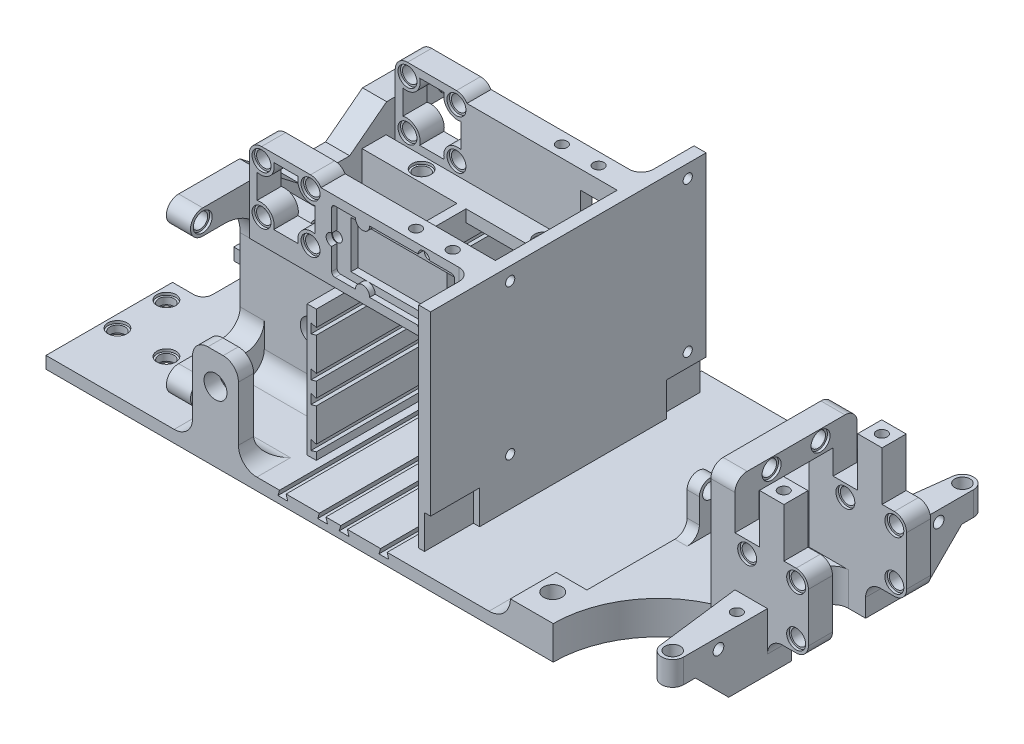
from build123d import *

# Parameters (mm, degrees)
SALIENTE_EXTRUIR1_DEPTH      = 42.87
SALIENTE_EXTRUIR1_DEPTH_BACK = 3.9
CROQUIS2_W                   = 41.87
CROQUIS2_H                   = 39.8
CROQUIS2_W_2                 = 31
CROQUIS2_H_2                 = 24.1
CROQUIS5_R                   = 3.75
CORTAR_EXTRUIR4_DEPTH        = 63.992331279
CROQUIS3_R                   = 2.485
CORTAR_EXTRUIR1_DEPTH        = 7.87
CROQUIS3_3_R                 = 2.485
CROQUIS3_3_R_2               = 3.1
CORTAR_EXTRUIR2_DEPTH        = 0.85
CORTAR_EXTRUIR3_START        = -7.02
CROQUIS3_4_R                 = 3.1
CROQUIS3_4_R_2               = 2.485
CORTAR_EXTRUIR3_DEPTH        = 0.85
CROQUIS4_W                   = 41.5
CROQUIS4_H                   = 7.9
CROQUIS4_R                   = 3.1
SALIENTE_EXTRUIR2_DEPTH      = 3.935
SALIENTE_EXTRUIR3_START      = -0.85
CROQUIS4_3_R                 = 3.1
CROQUIS4_3_R_2               = 2.485
SALIENTE_EXTRUIR3_DEPTH      = 2.235
CROQUIS6_W                   = 193.7
CROQUIS6_H                   = 102.67
CROQUIS6_R                   = 3.1
CROQUIS6_W_2                 = 31
CROQUIS6_H_2                 = 24.1
SALIENTE_EXTRUIR4_DEPTH      = 3.935
SALIENTE_EXTRUIR6_START      = 0.85
CROQUIS6_5_R                 = 3.1
CROQUIS6_5_R_2               = 2.485
SALIENTE_EXTRUIR6_DEPTH      = 2.235
CORTAR_EXTRUIR7_REACH        = 158.006
CROQUIS10_R                  = 3.1
SALIENTE_EXTRUIR7_DEPTH      = 7.87
SALIENTE_EXTRUIR8_START      = -0.85
CROQUIS10_3_R                = 3.1
CROQUIS10_3_R_2              = 2.485
SALIENTE_EXTRUIR8_DEPTH      = 6.17
CROQUIS12_R                  = 3.1
CROQUIS12_W                  = 24
CROQUIS12_H                  = 3.935
SALIENTE_EXTRUIR11_DEPTH     = 7.87
SALIENTE_EXTRUIR15_START     = 0.85
CROQUIS12_5_R                = 3.1
CROQUIS12_5_R_2              = 2.485
SALIENTE_EXTRUIR15_DEPTH     = 6.17
SALIENTE_EXTRUIR13_START     = -46.82
CROQUIS12_4_R                = 3.1
CROQUIS12_4_R_2              = 2.485
SALIENTE_EXTRUIR13_DEPTH     = 6.17
SALIENTE_EXTRUIR14_DEPTH     = 7.87
CORTAR_EXTRUIR8_START        = 7.87
CORTAR_EXTRUIR8_DEPTH        = 1.8
CROQUIS14_R                  = 1.6
CORTAR_EXTRUIR10_DEPTH       = 2.3
CORTAR_EXTRUIR11_START       = -51.94
CROQUIS14_3_R                = 1.6
CORTAR_EXTRUIR11_DEPTH       = 1.8
CROQUIS18_W                  = 12
CROQUIS18_H                  = 14
CORTAR_EXTRUIR14_DEPTH       = 173.813155822
CROQUIS23_W                  = 32
CROQUIS23_H                  = 102.67
SALIENTE_EXTRUIR16_DEPTH     = 6.97
CROQUIS25_R                  = 3.1
SALIENTE_EXTRUIR18_DEPTH     = 7.87
SALIENTE_EXTRUIR19_START     = -0.85
CROQUIS25_3_R                = 3.1
CROQUIS25_3_R_2              = 2.485
SALIENTE_EXTRUIR19_DEPTH     = 6.17
CROQUIS27_R                  = 2.525
SALIENTE_EXTRUIR20_DEPTH     = 4
CROQUIS30_R                  = 3.1
SALIENTE_EXTRUIR21_DEPTH     = 7.87
SALIENTE_EXTRUIR22_START     = -0.85
CROQUIS30_3_R                = 3.1
CROQUIS30_3_R_2              = 2.485
SALIENTE_EXTRUIR22_DEPTH     = 6.17
CORTAR_EXTRUIR15_DEPTH       = 182.802877727
CROQUIS24_4_R                = 2.5
SALIENTE_EXTRUIR23_DEPTH     = 7.87
SALIENTE_EXTRUIR28_START     = -10.62
SALIENTE_EXTRUIR28_DEPTH     = 10.62
CORTAR_EXTRUIR25_REACH       = 183.803
SALIENTE_EXTRUIR24_START     = 25.05
CROQUIS30_5_R                = 3.1
CROQUIS30_5_R_2              = 2.485
SALIENTE_EXTRUIR24_DEPTH     = 6.17
REDONDEO10_R                 = 5
CROQUIS52_W                  = 10
CROQUIS52_H                  = 15
SALIENTE_EXTRUIR29_DEPTH     = 6.97
CROQUIS34_R                  = 3
CORTAR_EXTRUIR19_DEPTH       = 5
CROQUIS39_R                  = 1.75
CORTAR_EXTRUIR20_DEPTH       = 5
CROQUIS41_R                  = 3.75
SALIENTE_EXTRUIR26_DEPTH     = 4.97
CROQUIS47_W                  = 90
CROQUIS47_H                  = 68.8
CROQUIS47_R                  = 1.5
SALIENTE_EXTRUIR27_DEPTH     = 3.935
REDONDEO7_R                  = 4
REDONDEO8_R                  = 7.87
REDONDEO9_R                  = 6
CROQUIS50_R                  = 1.75
CORTAR_EXTRUIR26_DEPTH       = 5
CROQUIS51_R                  = 1.75
CORTAR_EXTRUIR27_DEPTH       = 5
CROQUIS53_W                  = 8
CROQUIS53_H                  = 7.87
SALIENTE_EXTRUIR30_DEPTH     = 16
CROQUIS54_R                  = 1.75
CORTAR_EXTRUIR28_DEPTH       = 5
REDONDEO11_R                 = 6.97
CROQUIS55_W                  = 13
CROQUIS55_H                  = 11
CROQUIS55_W_2                = 16
CORTAR_EXTRUIR29_DEPTH       = 2
REDONDEO12_R                 = 4
CROQUIS56_W                  = 3
CROQUIS56_H                  = 17
SALIENTE_EXTRUIR33_DEPTH     = 42.8
CORTAR_EXTRUIR30_DEPTH       = 204.380812025


with BuildPart() as part:
    # Croquis2 → Saliente-Extruir1 (new, two sides: drawn at the far end of the back side and taken through both)
    with BuildSketch(Plane(origin=(0, 0, 0), x_dir=(1, 0, 0), z_dir=(0, 1, 0)).offset(-SALIENTE_EXTRUIR1_DEPTH_BACK)):
        with Locations((-2.435, 0)):
            Rectangle(CROQUIS2_W, CROQUIS2_H)
        Rectangle(CROQUIS2_W_2, CROQUIS2_H_2, mode=Mode.SUBTRACT)
    extrude(amount=SALIENTE_EXTRUIR1_DEPTH + SALIENTE_EXTRUIR1_DEPTH_BACK)

    # Croquis5 → Cortar-Extruir4 (cut, through all)
    with BuildSketch(Plane.XY.offset(19.9)):
        with Locations((0, 15)):
            Circle(CROQUIS5_R)
    extrude(amount=-CORTAR_EXTRUIR4_DEPTH, mode=Mode.SUBTRACT)

    # Croquis3 → Cortar-Extruir1 (cut)
    with BuildSketch(Plane(origin=(0, 42.87, 0), x_dir=(1, 0, 0), z_dir=(0, 1, 0))):
        with Locations(Location((0, -16, 0), (0, 0, 270))):
            Circle(CROQUIS3_R)
    cortar_extruir1 = extrude(amount=-CORTAR_EXTRUIR1_DEPTH, mode=Mode.SUBTRACT)

    # Croquis3<3> → Cortar-Extruir2 (cut)
    with BuildSketch(Plane(origin=(0, 42.87, 0), x_dir=(1, 0, 0), z_dir=(0, 1, 0))):
        with Locations(Location((0, -16, 0), (0, 0, 270))):
            Circle(CROQUIS3_3_R)
        with Locations(Location((0, -16, 0), (0, 0, 270))):
            Circle(CROQUIS3_3_R_2)
    cortar_extruir2 = extrude(amount=-CORTAR_EXTRUIR2_DEPTH, mode=Mode.SUBTRACT)

    # Croquis3<4> → Cortar-Extruir3 (cut)
    with BuildSketch(Plane(origin=(0, 42.87, 0), x_dir=(1, 0, 0), z_dir=(0, 1, 0)).offset(CORTAR_EXTRUIR3_START)):
        with Locations(Location((0, -16, 0), (0, 0, 270))):
            Circle(CROQUIS3_4_R)
        with Locations(Location((0, -16, 0), (0, 0, 270))):
            Circle(CROQUIS3_4_R_2, mode=Mode.SUBTRACT)
    cortar_extruir3 = extrude(amount=-CORTAR_EXTRUIR3_DEPTH, mode=Mode.SUBTRACT)

    # Simetría1: Cortar-Extruir1, Cortar-Extruir2, Cortar-Extruir3 across plane
    add(cortar_extruir1.mirror(Plane.XY), mode=Mode.SUBTRACT)
    add(cortar_extruir2.mirror(Plane.XY), mode=Mode.SUBTRACT)
    add(cortar_extruir3.mirror(Plane.XY), mode=Mode.SUBTRACT)

    # Croquis4 → Saliente-Extruir2 (add)
    with BuildSketch(Plane(origin=(0, 42.87, 0), x_dir=(1, 0, 0), z_dir=(0, 1, 0))):
        with Locations((39.25, -15.95)):
            Rectangle(CROQUIS4_W, CROQUIS4_H)
        with Locations(Location((40, -16, 0), (0, 0, 270))):
            Circle(CROQUIS4_R, mode=Mode.SUBTRACT)
        with Locations(Location((56, -16, 0), (0, 0, 270))):
            Circle(CROQUIS4_R, mode=Mode.SUBTRACT)
    saliente_extruir2 = extrude(amount=-SALIENTE_EXTRUIR2_DEPTH)

    # Croquis4<3> → Saliente-Extruir3 (add)
    # profile 1 of 2: a face of its own
    with BuildSketch(Plane(origin=(0, 42.87, 0), x_dir=(1, 0, 0), z_dir=(0, 1, 0)).offset(SALIENTE_EXTRUIR3_START)):
        with Locations(Location((40, -16, 0), (0, 0, 270))):
            Circle(CROQUIS4_3_R)
        with Locations(Location((40, -16, 0), (0, 0, 270))):
            Circle(CROQUIS4_3_R_2, mode=Mode.SUBTRACT)
    # profile 2 of 2: a face of its own
    with BuildSketch(Plane(origin=(0, 42.87, 0), x_dir=(1, 0, 0), z_dir=(0, 1, 0)).offset(SALIENTE_EXTRUIR3_START)):
        with Locations(Location((56, -16, 0), (0, 0, 270))):
            Circle(CROQUIS4_3_R)
        with Locations(Location((56, -16, 0), (0, 0, 270))):
            Circle(CROQUIS4_3_R_2, mode=Mode.SUBTRACT)
    saliente_extruir3 = extrude(amount=-SALIENTE_EXTRUIR3_DEPTH)

    # Simetría11: Saliente-Extruir2 across plane
    add(saliente_extruir2.mirror(Plane.XY))

    # Simetría13: Saliente-Extruir3 across plane
    add(saliente_extruir3.mirror(Plane.XY))

    # Croquis6 → Saliente-Extruir4 (add)
    with BuildSketch(Plane(origin=(0, -7.8, 0), x_dir=(1, 0, 0), z_dir=(0, 1, 0))):
        with Locations((41.48, 0)):
            Rectangle(CROQUIS6_W, CROQUIS6_H)
        with Locations(Location((-51.37, -32, 0), (0, 0, 270))):
            Circle(CROQUIS6_R, mode=Mode.SUBTRACT)
        with Locations(Location((-35.37, -32, 0), (0, 0, 270))):
            Circle(CROQUIS6_R, mode=Mode.SUBTRACT)
        with Locations(Location((-51.37, -16, 0), (0, 0, 270))):
            Circle(CROQUIS6_R, mode=Mode.SUBTRACT)
        with Locations(Location((-51.37, 16, 0), (0, 0, 270))):
            Circle(CROQUIS6_R, mode=Mode.SUBTRACT)
        Rectangle(CROQUIS6_W_2, CROQUIS6_H_2, mode=Mode.SUBTRACT)
        with Locations(Location((-51.37, 32, 0), (0, 0, 270))):
            Circle(CROQUIS6_R, mode=Mode.SUBTRACT)
        with Locations(Location((-35.37, 32, 0), (0, 0, 270))):
            Circle(CROQUIS6_R, mode=Mode.SUBTRACT)
    extrude(amount=SALIENTE_EXTRUIR4_DEPTH)

    # Croquis6<5> → Saliente-Extruir6 (add)
    # profile 1 of 6: a face of its own
    with BuildSketch(Plane(origin=(0, -7.8, 0), x_dir=(1, 0, 0), z_dir=(0, 1, 0)).offset(SALIENTE_EXTRUIR6_START)):
        with Locations(Location((-51.37, -32, 0), (0, 0, 270))):
            Circle(CROQUIS6_5_R)
        with Locations(Location((-51.37, -32, 0), (0, 0, 270))):
            Circle(CROQUIS6_5_R_2, mode=Mode.SUBTRACT)
    # profile 2 of 6: a face of its own
    with BuildSketch(Plane(origin=(0, -7.8, 0), x_dir=(1, 0, 0), z_dir=(0, 1, 0)).offset(SALIENTE_EXTRUIR6_START)):
        with Locations(Location((-51.37, -16, 0), (0, 0, 270))):
            Circle(CROQUIS6_5_R)
        with Locations(Location((-51.37, -16, 0), (0, 0, 270))):
            Circle(CROQUIS6_5_R_2, mode=Mode.SUBTRACT)
    # profile 3 of 6: a face of its own
    with BuildSketch(Plane(origin=(0, -7.8, 0), x_dir=(1, 0, 0), z_dir=(0, 1, 0)).offset(SALIENTE_EXTRUIR6_START)):
        with Locations(Location((-35.37, -32, 0), (0, 0, 270))):
            Circle(CROQUIS6_5_R)
        with Locations(Location((-35.37, -32, 0), (0, 0, 270))):
            Circle(CROQUIS6_5_R_2, mode=Mode.SUBTRACT)
    # profile 4 of 6: a face of its own
    with BuildSketch(Plane(origin=(0, -7.8, 0), x_dir=(1, 0, 0), z_dir=(0, 1, 0)).offset(SALIENTE_EXTRUIR6_START)):
        with Locations(Location((-35.37, 32, 0), (0, 0, 270))):
            Circle(CROQUIS6_5_R)
        with Locations(Location((-35.37, 32, 0), (0, 0, 270))):
            Circle(CROQUIS6_5_R_2, mode=Mode.SUBTRACT)
    # profile 5 of 6: a face of its own
    with BuildSketch(Plane(origin=(0, -7.8, 0), x_dir=(1, 0, 0), z_dir=(0, 1, 0)).offset(SALIENTE_EXTRUIR6_START)):
        with Locations(Location((-51.37, 32, 0), (0, 0, 270))):
            Circle(CROQUIS6_5_R)
        with Locations(Location((-51.37, 32, 0), (0, 0, 270))):
            Circle(CROQUIS6_5_R_2, mode=Mode.SUBTRACT)
    # profile 6 of 6: a face of its own
    with BuildSketch(Plane(origin=(0, -7.8, 0), x_dir=(1, 0, 0), z_dir=(0, 1, 0)).offset(SALIENTE_EXTRUIR6_START)):
        with Locations(Location((-51.37, 16, 0), (0, 0, 270))):
            Circle(CROQUIS6_5_R)
        with Locations(Location((-51.37, 16, 0), (0, 0, 270))):
            Circle(CROQUIS6_5_R_2, mode=Mode.SUBTRACT)
    extrude(amount=SALIENTE_EXTRUIR6_DEPTH)

    # Croquis9 → Cortar-Extruir7 (cut, up to next)
    with BuildSketch(Plane.XZ.offset(7.8), mode=Mode.PRIVATE) as cortar_extruir7_sk1:
        with BuildLine():
            Line((-55.37, 10), (-48.37, 10))
            ThreePointArc((-48.37, 10), (-46.248679656, 9.121320344), (-45.37, 7))
            Line((-45.37, 7), (-45.37, -7))
            ThreePointArc((-45.37, -7), (-46.248679656, -9.121320344), (-48.37, -10))
            Line((-48.37, -10), (-55.37, -10))
            Line((-55.37, -10), (-55.37, 10))
        make_face()
    cortar_extruir7_tool1 = extrude(cortar_extruir7_sk1.sketch, amount=-CORTAR_EXTRUIR7_REACH, mode=Mode.PRIVATE) & part.part
    add(cortar_extruir7_tool1.solids().sort_by_distance((-50.455275, -7.8, 0))[0], mode=Mode.SUBTRACT)

    # Croquis10 → Saliente-Extruir7 (add)
    # profile 1 of 2: a face of its own
    with BuildSketch(Plane.ZY.offset(23.37)):
        with BuildLine():
            Line((-19.9, -3.865), (-19.9, 4.135))
            Line((-19.9, 4.135), (-40, 4.135))
            ThreePointArc((-40, 4.135), (-44, 0.135), (-40, -3.865))
            Line((-40, -3.865), (-19.9, -3.865))
        make_face()
        with Locations((-40, 0.135)):
            Circle(CROQUIS10_R, mode=Mode.SUBTRACT)
    # profile 2 of 2: a face of its own
    with BuildSketch(Plane.ZY.offset(23.37)):
        with BuildLine():
            ThreePointArc((-32.9, 44.135), (-23.707611845, 40.327388155), (-19.9, 31.135))
            Line((-19.9, 31.135), (-19.9, 42.87))
            Line((-19.9, 42.87), (-8, 42.87))
            Line((-8, 42.87), (-20.074383079, 52.135))
            Line((-20.074383079, 52.135), (-40, 52.135))
            ThreePointArc((-40, 52.135), (-44, 48.135), (-40, 44.135))
            Line((-40, 44.135), (-32.9, 44.135))
        make_face()
        with Locations((-40, 48.135)):
            Circle(CROQUIS10_R, mode=Mode.SUBTRACT)
    saliente_extruir7 = extrude(amount=-SALIENTE_EXTRUIR7_DEPTH)

    # Croquis10<3> → Saliente-Extruir8 (add)
    # profile 1 of 2: a face of its own
    with BuildSketch(Plane.ZY.offset(23.37).offset(SALIENTE_EXTRUIR8_START)):
        with Locations((-40, 0.135)):
            Circle(CROQUIS10_3_R)
        with Locations((-40, 0.135)):
            Circle(CROQUIS10_3_R_2, mode=Mode.SUBTRACT)
    # profile 2 of 2: a face of its own
    with BuildSketch(Plane.ZY.offset(23.37).offset(SALIENTE_EXTRUIR8_START)):
        with Locations((-40, 48.135)):
            Circle(CROQUIS10_3_R)
        with Locations((-40, 48.135)):
            Circle(CROQUIS10_3_R_2, mode=Mode.SUBTRACT)
    saliente_extruir8 = extrude(amount=-SALIENTE_EXTRUIR8_DEPTH)

    # Simetría14: Saliente-Extruir7, Saliente-Extruir8 across plane
    add(saliente_extruir7.mirror(Plane.XY))
    add(saliente_extruir8.mirror(Plane.XY))

    # Croquis12 → Saliente-Extruir11 (add)
    # profile 1 of 2: a face of its own
    with BuildSketch(Plane.XY.offset(19.9)):
        with BuildLine():
            Line((7.48, 66.87), (-8.52, 66.87))
            ThreePointArc((-8.52, 66.87), (-11.348427125, 65.698427125), (-12.52, 62.87))
            Line((-12.52, 62.87), (-12.52, 42.87))
            Line((-12.52, 42.87), (11.48, 42.87))
            Line((11.48, 42.87), (11.48, 62.87))
            ThreePointArc((11.48, 62.87), (10.308427125, 65.698427125), (7.48, 66.87))
        make_face()
        with Locations((-8.52, 46.87)):
            Circle(CROQUIS12_R, mode=Mode.SUBTRACT)
        with Locations((7.48, 46.87)):
            Circle(CROQUIS12_R, mode=Mode.SUBTRACT)
        with Locations((-8.52, 62.87)):
            Circle(CROQUIS12_R, mode=Mode.SUBTRACT)
        with BuildLine():
            ThreePointArc((8.98, 50.87), (4.648800544, 49.701199456), (3.48, 45.37))
            Line((3.48, 45.37), (-4.52, 45.37))
            ThreePointArc((-4.52, 45.37), (-5.688800544, 49.701199456), (-10.02, 50.87))
            Line((-10.02, 50.87), (-10.02, 58.87))
            ThreePointArc((-10.02, 58.87), (-5.688800544, 60.038800544), (-4.52, 64.37))
            Line((-4.52, 64.37), (3.48, 64.37))
            ThreePointArc((3.48, 64.37), (4.648800544, 60.038800544), (8.98, 58.87))
            Line((8.98, 58.87), (8.98, 50.87))
        make_face(mode=Mode.SUBTRACT)
        with Locations((7.48, 62.87)):
            Circle(CROQUIS12_R, mode=Mode.SUBTRACT)
    # profile 2 of 2: a face of its own
    with BuildSketch(Plane.XY.offset(19.9)):
        with Locations((-0.52, 40.9025)):
            Rectangle(CROQUIS12_W, CROQUIS12_H)
    saliente_extruir11 = extrude(amount=SALIENTE_EXTRUIR11_DEPTH)

    # Croquis12<5> → Saliente-Extruir15 (add)
    # profile 1 of 4: a face of its own
    with BuildSketch(Plane.XY.offset(19.9).offset(SALIENTE_EXTRUIR15_START)):
        with Locations((7.48, 62.87)):
            Circle(CROQUIS12_5_R)
        with Locations((7.48, 62.87)):
            Circle(CROQUIS12_5_R_2, mode=Mode.SUBTRACT)
    # profile 2 of 4: a face of its own
    with BuildSketch(Plane.XY.offset(19.9).offset(SALIENTE_EXTRUIR15_START)):
        with Locations((7.48, 46.87)):
            Circle(CROQUIS12_5_R)
        with Locations((7.48, 46.87)):
            Circle(CROQUIS12_5_R_2, mode=Mode.SUBTRACT)
    # profile 3 of 4: a face of its own
    with BuildSketch(Plane.XY.offset(19.9).offset(SALIENTE_EXTRUIR15_START)):
        with Locations((-8.52, 62.87)):
            Circle(CROQUIS12_5_R)
        with Locations((-8.52, 62.87)):
            Circle(CROQUIS12_5_R_2, mode=Mode.SUBTRACT)
    # profile 4 of 4: a face of its own
    with BuildSketch(Plane.XY.offset(19.9).offset(SALIENTE_EXTRUIR15_START)):
        with Locations((-8.52, 46.87)):
            Circle(CROQUIS12_5_R)
        with Locations((-8.52, 46.87)):
            Circle(CROQUIS12_5_R_2, mode=Mode.SUBTRACT)
    extrude(amount=SALIENTE_EXTRUIR15_DEPTH)

    # Simetría31: Saliente-Extruir11 across plane
    add(saliente_extruir11.mirror(Plane.XY))

    # Croquis12<4> → Saliente-Extruir13 (add)
    # profile 1 of 4: a face of its own
    with BuildSketch(Plane.XY.offset(19.9).offset(SALIENTE_EXTRUIR13_START)):
        with Locations((7.48, 62.87)):
            Circle(CROQUIS12_4_R)
        with Locations((7.48, 62.87)):
            Circle(CROQUIS12_4_R_2, mode=Mode.SUBTRACT)
    # profile 2 of 4: a face of its own
    with BuildSketch(Plane.XY.offset(19.9).offset(SALIENTE_EXTRUIR13_START)):
        with Locations((-8.52, 62.87)):
            Circle(CROQUIS12_4_R)
        with Locations((-8.52, 62.87)):
            Circle(CROQUIS12_4_R_2, mode=Mode.SUBTRACT)
    # profile 3 of 4: a face of its own
    with BuildSketch(Plane.XY.offset(19.9).offset(SALIENTE_EXTRUIR13_START)):
        with Locations((-8.52, 46.87)):
            Circle(CROQUIS12_4_R)
        with Locations((-8.52, 46.87)):
            Circle(CROQUIS12_4_R_2, mode=Mode.SUBTRACT)
    # profile 4 of 4: a face of its own
    with BuildSketch(Plane.XY.offset(19.9).offset(SALIENTE_EXTRUIR13_START)):
        with Locations((7.48, 46.87)):
            Circle(CROQUIS12_4_R)
        with Locations((7.48, 46.87)):
            Circle(CROQUIS12_4_R_2, mode=Mode.SUBTRACT)
    extrude(amount=SALIENTE_EXTRUIR13_DEPTH)

    # Croquis13 → Saliente-Extruir14 (add)
    with BuildSketch(Plane.XY.offset(19.9)):
        with BuildLine():
            Line((11.48, 38.935), (60, 38.935))
            Line((60, 38.935), (60, 64.935))
            Line((60, 64.935), (10.905751742, 64.935))
            ThreePointArc((10.905751742, 64.935), (11.333764846, 63.941679297), (11.48, 62.87))
            Line((11.48, 62.87), (11.48, 38.935))
        make_face()
    saliente_extruir14 = extrude(amount=SALIENTE_EXTRUIR14_DEPTH)

    # Croquis13<5> → Cortar-Extruir8 (cut)
    with BuildSketch(Plane.XY.offset(19.9).offset(CORTAR_EXTRUIR8_START)):
        with BuildLine():
            Line((14.38, 50.037633404), (14.38, 42.935))
            ThreePointArc((14.38, 42.935), (14.702182541, 42.157182541), (15.48, 41.835))
            Line((15.48, 41.835), (22.182174941, 41.835))
            ThreePointArc((22.182174941, 41.835), (24.48, 44.235), (26.777825059, 41.835))
            Line((26.777825059, 41.835), (42.582633404, 41.835))
            ThreePointArc((42.582633404, 41.835), (44.48, 40.035), (46.377366596, 41.835))
            Line((46.377366596, 41.835), (53.48, 41.835))
            ThreePointArc((53.48, 41.835), (54.257817459, 42.157182541), (54.58, 42.935))
            Line((54.58, 42.935), (54.58, 49.637174941))
            ThreePointArc((54.58, 49.637174941), (52.18, 51.935), (54.58, 54.232825059))
            Line((54.58, 54.232825059), (54.58, 60.935))
            ThreePointArc((54.58, 60.935), (54.257817459, 61.712817459), (53.48, 62.035))
            Line((53.48, 62.035), (46.377366596, 62.035))
            ThreePointArc((46.377366596, 62.035), (44.48, 63.835), (42.582633404, 62.035))
            Line((42.582633404, 62.035), (26.777825059, 62.035))
            ThreePointArc((26.777825059, 62.035), (24.48, 59.635), (22.182174941, 62.035))
            Line((22.182174941, 62.035), (15.48, 62.035))
            ThreePointArc((15.48, 62.035), (14.702182541, 61.712817459), (14.38, 60.935))
            Line((14.38, 60.935), (14.38, 53.832366596))
            ThreePointArc((14.38, 53.832366596), (12.58, 51.935), (14.38, 50.037633404))
        make_face()
    extrude(amount=-CORTAR_EXTRUIR8_DEPTH, mode=Mode.SUBTRACT)

    # Croquis14 → Cortar-Extruir10 (cut)
    with BuildSketch(Plane.XY.offset(25.97)):
        with BuildLine():
            Line((54.58, 54.232825059), (54.58, 59.635))
            Line((54.58, 59.635), (24.480000037, 59.635))
            Line((24.480000037, 59.635), (18.88, 59.635))
            Line((18.88, 59.635), (18.88, 44.235))
            Line((18.88, 44.235), (24.48, 44.235))
            Line((24.48, 44.235), (54.58, 44.235))
            Line((54.58, 44.235), (54.58, 49.637174941))
            ThreePointArc((54.58, 49.637174941), (52.18, 51.935), (54.58, 54.232825059))
        make_face()
        with Locations((14.48, 51.935)):
            Circle(CROQUIS14_R)
        with Locations((44.48, 61.935)):
            Circle(CROQUIS14_R)
        with Locations((44.48, 41.935)):
            Circle(CROQUIS14_R)
    cortar_extruir10 = extrude(amount=-CORTAR_EXTRUIR10_DEPTH, mode=Mode.SUBTRACT)

    # Simetría34: Saliente-Extruir14, Cortar-Extruir10 across plane
    add(saliente_extruir14.mirror(Plane.XY))
    add(cortar_extruir10.mirror(Plane.XY), mode=Mode.SUBTRACT)

    # Croquis14<3> → Cortar-Extruir11 (cut)
    with BuildSketch(Plane.XY.offset(25.97).offset(CORTAR_EXTRUIR11_START)):
        with BuildLine():
            Line((53.48, 62.035), (46.377366596, 62.035))
            ThreePointArc((46.377366596, 62.035), (44.48, 63.835), (42.582633404, 62.035))
            Line((42.582633404, 62.035), (26.777825059, 62.035))
            ThreePointArc((26.777825059, 62.035), (24.48, 59.635), (22.182174941, 62.035))
            Line((22.182174941, 62.035), (15.48, 62.035))
            ThreePointArc((15.48, 62.035), (14.702182541, 61.712817459), (14.38, 60.935))
            Line((14.38, 60.935), (14.38, 53.832366596))
            ThreePointArc((14.38, 53.832366596), (12.58, 51.935), (14.38, 50.037633404))
            Line((14.38, 50.037633404), (14.38, 42.935))
            ThreePointArc((14.38, 42.935), (14.702182541, 42.157182541), (15.48, 41.835))
            Line((15.48, 41.835), (22.182174941, 41.835))
            ThreePointArc((22.182174941, 41.835), (24.48, 44.235), (26.777825059, 41.835))
            Line((26.777825059, 41.835), (42.582633404, 41.835))
            ThreePointArc((42.582633404, 41.835), (44.48, 40.035), (46.377366596, 41.835))
            Line((46.377366596, 41.835), (53.48, 41.835))
            ThreePointArc((53.48, 41.835), (54.257817459, 42.157182541), (54.58, 42.935))
            Line((54.58, 42.935), (54.58, 49.637174941))
            ThreePointArc((54.58, 49.637174941), (52.18, 51.935), (54.58, 54.232825059))
            Line((54.58, 54.232825059), (54.58, 60.935))
            ThreePointArc((54.58, 60.935), (54.257817459, 61.712817459), (53.48, 62.035))
        make_face()
        with Locations((14.48, 51.935)):
            Circle(CROQUIS14_3_R, mode=Mode.SUBTRACT)
        with Locations((44.48, 61.935)):
            Circle(CROQUIS14_3_R, mode=Mode.SUBTRACT)
        with Locations((44.48, 41.935)):
            Circle(CROQUIS14_3_R, mode=Mode.SUBTRACT)
    extrude(amount=-CORTAR_EXTRUIR11_DEPTH, mode=Mode.SUBTRACT)


with BuildPart() as cortar_extruir11_kept_piece:
    # of the separate pieces the step leaves, the one the design keeps (cortar_extruir11_pieces_kept)
    add(part.part.solids().sort_by_distance((-23.37, 4.135, -19.9))[0])

    # Croquis18 → Cortar-Extruir14 (cut, through all)
    with BuildSketch(Plane(origin=(0, 0, -27.77), x_dir=(-1, 0, 0), z_dir=(0, 0, -1))):
        with Locations((-54, 51.935)):
            Rectangle(CROQUIS18_W, CROQUIS18_H)
    extrude(amount=-CORTAR_EXTRUIR14_DEPTH, mode=Mode.SUBTRACT)

    # Croquis23 → Saliente-Extruir16 (add)
    with BuildSketch(Plane(origin=(0, -3.865, 0), x_dir=(1, 0, 0), z_dir=(0, 1, 0))):
        with Locations((122.33, 0)):
            Rectangle(CROQUIS23_W, CROQUIS23_H)
    extrude(amount=SALIENTE_EXTRUIR16_DEPTH)

    # Croquis25 → Saliente-Extruir18 (add)
    with BuildSketch(Plane(origin=(138.33, 0, 0), x_dir=(0, 0, -1), z_dir=(1, 0, 0))):
        with BuildLine():
            Line((-19.97, 3.105), (-12.1, 3.105))
            Line((-12.1, 3.105), (-12.1, 35.105))
            Line((-12.1, 35.105), (12.1, 35.105))
            Line((12.1, 35.105), (12.1, 3.105))
            Line((12.1, 3.105), (19.97, 3.105))
            Line((19.97, 3.105), (19.97, 38.505))
            ThreePointArc((19.97, 38.505), (18.798427125, 41.333427125), (15.97, 42.505))
            Line((15.97, 42.505), (-15.97, 42.505))
            ThreePointArc((-15.97, 42.505), (-18.798427125, 41.333427125), (-19.97, 38.505))
            Line((-19.97, 38.505), (-19.97, 3.105))
        make_face()
        with Locations((-8, 39.105)):
            Circle(CROQUIS25_R, mode=Mode.SUBTRACT)
        with Locations((8, 39.105)):
            Circle(CROQUIS25_R, mode=Mode.SUBTRACT)
    extrude(amount=-SALIENTE_EXTRUIR18_DEPTH)

    # Croquis25<3> → Saliente-Extruir19 (add)
    # profile 1 of 2: a face of its own
    with BuildSketch(Plane(origin=(138.33, 0, 0), x_dir=(0, 0, -1), z_dir=(1, 0, 0)).offset(SALIENTE_EXTRUIR19_START)):
        with Locations((-8, 39.105)):
            Circle(CROQUIS25_3_R)
        with Locations((-8, 39.105)):
            Circle(CROQUIS25_3_R_2, mode=Mode.SUBTRACT)
    # profile 2 of 2: a face of its own
    with BuildSketch(Plane(origin=(138.33, 0, 0), x_dir=(0, 0, -1), z_dir=(1, 0, 0)).offset(SALIENTE_EXTRUIR19_START)):
        with Locations((8, 39.105)):
            Circle(CROQUIS25_3_R)
        with Locations((8, 39.105)):
            Circle(CROQUIS25_3_R_2, mode=Mode.SUBTRACT)
    extrude(amount=-SALIENTE_EXTRUIR19_DEPTH)

    # Croquis27 → Saliente-Extruir20 (add)
    with BuildSketch(Plane.ZY.offset(-106.33)):
        with BuildLine():
            Line((3.6, 3.105), (-3.6, 3.105))
            Line((-3.6, 3.105), (-3.6, 15.105))
            ThreePointArc((-3.6, 15.105), (0, 18.705), (3.6, 15.105))
            Line((3.6, 15.105), (3.6, 3.105))
        make_face()
        with Locations((0, 15.105)):
            Circle(CROQUIS27_R, mode=Mode.SUBTRACT)
    extrude(amount=-SALIENTE_EXTRUIR20_DEPTH)

    # Croquis30 → Saliente-Extruir21 (add)
    with BuildSketch(Plane(origin=(0, 0, 12.1), x_dir=(-1, 0, 0), z_dir=(0, 0, -1))):
        with BuildLine():
            Line((-158.33, 3.105), (-138.33, 3.105))
            Line((-138.33, 3.105), (-138.33, 27.105))
            Line((-138.33, 27.105), (-158.33, 27.105))
            ThreePointArc((-158.33, 27.105), (-161.158427125, 25.933427125), (-162.33, 23.105))
            Line((-162.33, 23.105), (-162.33, 7.105))
            ThreePointArc((-162.33, 7.105), (-161.158427125, 4.276572875), (-158.33, 3.105))
        make_face()
        with Locations((-158.33, 7.105)):
            Circle(CROQUIS30_R, mode=Mode.SUBTRACT)
        with Locations((-158.33, 23.105)):
            Circle(CROQUIS30_R, mode=Mode.SUBTRACT)
        with Locations((-142.33, 23.105)):
            Circle(CROQUIS30_R, mode=Mode.SUBTRACT)
    saliente_extruir21 = extrude(amount=-SALIENTE_EXTRUIR21_DEPTH)

    # Croquis30<3> → Saliente-Extruir22 (add)
    # profile 1 of 3: a face of its own
    with BuildSketch(Plane(origin=(0, 0, 12.1), x_dir=(-1, 0, 0), z_dir=(0, 0, -1)).offset(SALIENTE_EXTRUIR22_START)):
        with Locations((-142.33, 23.105)):
            Circle(CROQUIS30_3_R)
        with Locations((-142.33, 23.105)):
            Circle(CROQUIS30_3_R_2, mode=Mode.SUBTRACT)
    # profile 2 of 3: a face of its own
    with BuildSketch(Plane(origin=(0, 0, 12.1), x_dir=(-1, 0, 0), z_dir=(0, 0, -1)).offset(SALIENTE_EXTRUIR22_START)):
        with Locations((-158.33, 23.105)):
            Circle(CROQUIS30_3_R)
        with Locations((-158.33, 23.105)):
            Circle(CROQUIS30_3_R_2, mode=Mode.SUBTRACT)
    # profile 3 of 3: a face of its own
    with BuildSketch(Plane(origin=(0, 0, 12.1), x_dir=(-1, 0, 0), z_dir=(0, 0, -1)).offset(SALIENTE_EXTRUIR22_START)):
        with Locations((-158.33, 7.105)):
            Circle(CROQUIS30_3_R)
        with Locations((-158.33, 7.105)):
            Circle(CROQUIS30_3_R_2, mode=Mode.SUBTRACT)
    extrude(amount=-SALIENTE_EXTRUIR22_DEPTH)

    # Croquis24 → Cortar-Extruir15 (cut, through all)
    with BuildSketch(Plane(origin=(0, 3.105, 0), x_dir=(1, 0, 0), z_dir=(0, 1, 0))):
        with BuildLine():
            Line((130.46, -19.97), (138.33, -19.97))
            Line((138.33, -19.97), (138.33, -51.335))
            Line((138.33, -51.335), (110.33, -51.335))
            ThreePointArc((110.33, -51.335), (115.795404812, -32.700488167), (130.46, -19.97))
        make_face()
    cortar_extruir15 = extrude(amount=-CORTAR_EXTRUIR15_DEPTH, mode=Mode.SUBTRACT)

    # Croquis24<4> → Saliente-Extruir23 (add)
    with BuildSketch(Plane(origin=(0, 3.105, 0), x_dir=(1, 0, 0), z_dir=(0, 1, 0))):
        with BuildLine():
            Line((138.33, -19.97), (141.777358352, -47.772980423))
            ThreePointArc((141.777358352, -47.772980423), (145.571912221, -50.923153902), (148.95, -47.33))
            Line((148.95, -47.33), (148.95, -19.97))
            Line((148.95, -19.97), (138.33, -19.97))
        make_face()
        with Locations(Location((145.35, -47.33, 0), (0, 0, 270))):
            Circle(CROQUIS24_4_R, mode=Mode.SUBTRACT)
    saliente_extruir23 = extrude(amount=SALIENTE_EXTRUIR23_DEPTH)

    # Croquis48 → Saliente-Extruir28 (add)
    with BuildSketch(Plane(origin=(148.95, 0, 0), x_dir=(0, 0, -1), z_dir=(1, 0, 0)).offset(SALIENTE_EXTRUIR28_START)):
        Polygon((-43.53, 3.105), (-32.625, -7.8), (-12.1, -7.8), (-12.1, 3.105), align=None)
    saliente_extruir28 = extrude(amount=SALIENTE_EXTRUIR28_DEPTH)

    # Croquis49 → Cortar-Extruir25 (cut, up to next)
    with BuildSketch(Plane(origin=(0, 3.105, 0), x_dir=(1, 0, 0), z_dir=(0, 1, 0)), mode=Mode.PRIVATE) as cortar_extruir25_sk1:
        Polygon((141.251261014, -43.53), (138.33, -19.97), (138.33, -43.53), align=None)
    cortar_extruir25_tool1 = extrude(cortar_extruir25_sk1.sketch, amount=-CORTAR_EXTRUIR25_REACH, mode=Mode.PRIVATE) & cortar_extruir11_kept_piece.part
    cortar_extruir25 = cortar_extruir25_tool1.solids().sort_by_distance((139.303754, 3.105, 35.676667))[0]
    add(cortar_extruir25, mode=Mode.SUBTRACT)

    # Simetría36: Saliente-Extruir21, Cortar-Extruir15, Saliente-Extruir23, Saliente-Extruir28, Cortar-Extruir25 across plane
    add(saliente_extruir21.mirror(Plane.XY))
    add(cortar_extruir15.mirror(Plane.XY), mode=Mode.SUBTRACT)
    add(saliente_extruir23.mirror(Plane.XY))
    add(saliente_extruir28.mirror(Plane.XY))
    add(cortar_extruir25.mirror(Plane.XY), mode=Mode.SUBTRACT)

    # Croquis30<5> → Saliente-Extruir24 (add)
    # profile 1 of 3: a face of its own
    with BuildSketch(Plane(origin=(0, 0, 12.1), x_dir=(-1, 0, 0), z_dir=(0, 0, -1)).offset(SALIENTE_EXTRUIR24_START)):
        with Locations((-142.33, 23.105)):
            Circle(CROQUIS30_5_R)
        with Locations((-142.33, 23.105)):
            Circle(CROQUIS30_5_R_2, mode=Mode.SUBTRACT)
    # profile 2 of 3: a face of its own
    with BuildSketch(Plane(origin=(0, 0, 12.1), x_dir=(-1, 0, 0), z_dir=(0, 0, -1)).offset(SALIENTE_EXTRUIR24_START)):
        with Locations((-158.33, 23.105)):
            Circle(CROQUIS30_5_R)
        with Locations((-158.33, 23.105)):
            Circle(CROQUIS30_5_R_2, mode=Mode.SUBTRACT)
    # profile 3 of 3: a face of its own
    with BuildSketch(Plane(origin=(0, 0, 12.1), x_dir=(-1, 0, 0), z_dir=(0, 0, -1)).offset(SALIENTE_EXTRUIR24_START)):
        with Locations((-158.33, 7.105)):
            Circle(CROQUIS30_5_R)
        with Locations((-158.33, 7.105)):
            Circle(CROQUIS30_5_R_2, mode=Mode.SUBTRACT)
    extrude(amount=SALIENTE_EXTRUIR24_DEPTH)

    # Redondeo10
    redondeo10_edges = [cortar_extruir11_kept_piece.edges().sort_by_distance(p)[0] for p in [
        (138.33, -2.3475, -12.1),
        (148.95, 3.105, -16.035),
        (148.95, 3.105, 16.035),
    ]]
    fillet(redondeo10_edges, radius=REDONDEO10_R)

    # Croquis52 → Saliente-Extruir29 (add)
    with BuildSketch(Plane(origin=(0, -3.865, 0), x_dir=(1, 0, 0), z_dir=(0, 1, 0))):
        with Locations((101.33, 43.835)):
            Rectangle(CROQUIS52_W, CROQUIS52_H)
        with Locations((101.33, -43.835)):
            Rectangle(CROQUIS52_W, CROQUIS52_H)
    extrude(amount=SALIENTE_EXTRUIR29_DEPTH)

    # Croquis34 → Cortar-Extruir19 (cut)
    with BuildSketch(Plane(origin=(0, 3.105, 0), x_dir=(1, 0, 0), z_dir=(0, 1, 0))):
        with Locations(Location((101.33, -42.5, 0), (0, 0, 270))):
            Circle(CROQUIS34_R)
        with Locations(Location((101.33, 42.5, 0), (0, 0, 270))):
            Circle(CROQUIS34_R)
    extrude(amount=-CORTAR_EXTRUIR19_DEPTH, mode=Mode.SUBTRACT)

    # Croquis39 → Cortar-Extruir20 (cut)
    with BuildSketch(Plane(origin=(0, 64.935, 0), x_dir=(1, 0, 0), z_dir=(0, 1, 0))):
        with Locations(Location((38, 23.835, 0), (0, 0, 270))):
            Circle(CROQUIS39_R)
        with Locations(Location((50, 23.835, 0), (0, 0, 270))):
            Circle(CROQUIS39_R)
        with Locations(Location((50, -23.835, 0), (0, 0, 90))):
            Circle(CROQUIS39_R)
        with Locations(Location((38, -23.835, 0), (0, 0, 90))):
            Circle(CROQUIS39_R)
    extrude(amount=-CORTAR_EXTRUIR20_DEPTH, mode=Mode.SUBTRACT)

    # Croquis41 → Saliente-Extruir26 (add)
    with BuildSketch(Plane.XY.offset(51.335)):
        with BuildLine():
            Line((-7.5, 20), (-7.5, -3.865))
            Line((-7.5, -3.865), (7.5, -3.865))
            Line((7.5, -3.865), (7.5, 20))
            ThreePointArc((7.5, 20), (6.035533906, 23.535533906), (2.5, 25))
            Line((2.5, 25), (-2.5, 25))
            ThreePointArc((-2.5, 25), (-6.035533906, 23.535533906), (-7.5, 20))
        make_face()
        with Locations((0, 15)):
            Circle(CROQUIS41_R, mode=Mode.SUBTRACT)
    saliente_extruir26 = extrude(amount=-SALIENTE_EXTRUIR26_DEPTH)

    # Simetría37: Saliente-Extruir26 across plane
    add(saliente_extruir26.mirror(Plane.XY))

    # Croquis47 → Saliente-Extruir27 (add)
    with BuildSketch(Plane(origin=(60, 0, 0), x_dir=(0, 0, -1), z_dir=(1, 0, 0))):
        with Locations((0, 30.535)):
            Rectangle(CROQUIS47_W, CROQUIS47_H)
        with Locations(Location((-19, 60.635, 0), (0, 0, 233.130102354))):
            Circle(CROQUIS47_R, mode=Mode.SUBTRACT)
        with Locations((39, 60.635)):
            Circle(CROQUIS47_R, mode=Mode.SUBTRACT)
        with Locations((39, 11.635)):
            Circle(CROQUIS47_R, mode=Mode.SUBTRACT)
        with Locations((-19, 11.635)):
            Circle(CROQUIS47_R, mode=Mode.SUBTRACT)
    extrude(amount=SALIENTE_EXTRUIR27_DEPTH)

    # Redondeo7
    redondeo7_edges = [cortar_extruir11_kept_piece.edges().sort_by_distance(p)[0] for p in [
        (60, 40.9025, -12),
        (60, 41.935, 27.77),
        (60, 41.935, -27.77),
        (60, 61.935, -27.77),
        (60, 61.935, 27.77),
        (60, 40.9025, 12),
    ]]
    fillet(redondeo7_edges, radius=REDONDEO7_R)

    # Redondeo8
    redondeo8_edges = [cortar_extruir11_kept_piece.edges().sort_by_distance(p)[0] for p in [
        (2.99, 38.935, -19.9),
        (2.99, 38.935, 19.9),
    ]]
    fillet(redondeo8_edges, radius=REDONDEO8_R - 0.0001)  # a hair under: the kernel refuses the full size

    # Redondeo9
    redondeo9_edges = [cortar_extruir11_kept_piece.edges().sort_by_distance(p)[0] for p in [
        (7.5, -3.865, 48.85),
        (-7.5, -3.865, 48.85),
        (0, -3.865, 46.365),
        (0, -3.865, -46.365),
        (-7.5, -3.865, -48.85),
        (7.5, -3.865, -48.85),
        (1.5, -3.865, 19.9),
        (1.5, -3.865, -19.9),
        (-19.435, 4.135, -19.9),
        (-19.435, 4.135, 19.9),
    ]]
    fillet(redondeo9_edges, radius=REDONDEO9_R)

    # Croquis50 → Cortar-Extruir26 (cut)
    with BuildSketch(Plane(origin=(0, 10.975, 0), x_dir=(1, 0, 0), z_dir=(0, 1, 0))):
        with Locations(Location((144.95, -25.97, 0), (0, 0, 270))):
            Circle(CROQUIS50_R)
    cortar_extruir26 = extrude(amount=-CORTAR_EXTRUIR26_DEPTH, mode=Mode.SUBTRACT)

    # Croquis51 → Cortar-Extruir27 (cut)
    with BuildSketch(Plane(origin=(148.95, 0, 0), x_dir=(0, 0, -1), z_dir=(1, 0, 0))):
        with Locations((-35.97, 7.475)):
            Circle(CROQUIS51_R)
    cortar_extruir27 = extrude(amount=-CORTAR_EXTRUIR27_DEPTH, mode=Mode.SUBTRACT)

    # Simetría38: Cortar-Extruir26, Cortar-Extruir27 across plane
    add(cortar_extruir26.mirror(Plane.XY), mode=Mode.SUBTRACT)
    add(cortar_extruir27.mirror(Plane.XY), mode=Mode.SUBTRACT)

    # Croquis53 → Saliente-Extruir30 (add)
    with BuildSketch(Plane(origin=(0, 27.105, 0), x_dir=(1, 0, 0), z_dir=(0, 1, 0))):
        with Locations((150.33, -16.035)):
            Rectangle(CROQUIS53_W, CROQUIS53_H)
        with Locations((150.33, 16.035)):
            Rectangle(CROQUIS53_W, CROQUIS53_H)
    extrude(amount=SALIENTE_EXTRUIR30_DEPTH)

    # Croquis54 → Cortar-Extruir28 (cut)
    with BuildSketch(Plane(origin=(0, 43.105, 0), x_dir=(1, 0, 0), z_dir=(0, 1, 0))):
        with Locations(Location((150.33, 16.035, 0), (0, 0, 270))):
            Circle(CROQUIS54_R)
        with Locations(Location((150.33, -16.035, 0), (0, 0, 270))):
            Circle(CROQUIS54_R)
    extrude(amount=-CORTAR_EXTRUIR28_DEPTH, mode=Mode.SUBTRACT)

    # Redondeo11
    redondeo11_edges = [cortar_extruir11_kept_piece.edges().sort_by_distance(p)[0] for p in [
        (96.33, -3.865, 43.835),
        (101.33, -3.865, 36.335),
        (106.33, -3.865, 0),
        (101.33, -3.865, -36.335),
        (96.33, -3.865, -43.835),
    ]]
    fillet(redondeo11_edges, radius=REDONDEO11_R - 0.0001)  # a hair under: the kernel refuses the full size

    # Croquis55 → Cortar-Extruir29 (cut)
    with BuildSketch(Plane(origin=(63.935, 0, 0), x_dir=(0, 0, -1), z_dir=(1, 0, 0))):
        with Locations((38.5, 1.635)):
            Rectangle(CROQUIS55_W, CROQUIS55_H)
        with Locations((-37, 1.635)):
            Rectangle(CROQUIS55_W_2, CROQUIS55_H)
    extrude(amount=-CORTAR_EXTRUIR29_DEPTH, mode=Mode.SUBTRACT)

    # Redondeo12
    redondeo12_edges = [cortar_extruir11_kept_piece.edges().sort_by_distance(p)[0] for p in [
        (108.33, 3.105, 3.6),
        (108.33, 3.105, -3.6),
    ]]
    fillet(redondeo12_edges, radius=REDONDEO12_R)

    # Croquis56 → Saliente-Extruir33 (add)
    with BuildSketch(Plane(origin=(0, -3.865, 0), x_dir=(1, 0, 0), z_dir=(0, 1, 0))):
        with Locations((17, 28.4)):
            Rectangle(CROQUIS56_W, CROQUIS56_H)
        with Locations((17, -28.4)):
            Rectangle(CROQUIS56_W, CROQUIS56_H)
    extrude(amount=SALIENTE_EXTRUIR33_DEPTH)

    # Croquis57 → Cortar-Extruir30 (cut, through all)
    with BuildSketch(Plane(origin=(0, 0, -51.335), x_dir=(-1, 0, 0), z_dir=(0, 0, -1))):
        Polygon((-18.5, -1.365), (-18.5, -1.437964892), (-16.73, -1.958553127), (-16.73, 1.228553127), (-18.5, 0.707964892), (-18.5, 0.635), (-16.8, 1.135), (-16.8, -1.865), align=None)
        Polygon((-18.5, 0.635), (-18.5, -1.365), (-16.8, -1.865), (-16.8, 1.135), align=None)
        Polygon((-18.5, 13.635), (-18.5, 11.635), (-16.8, 11.135), (-16.8, 14.135), align=None)
        Polygon((-18.5, 11.635), (-18.5, 11.562035108), (-16.73, 11.041446873), (-16.73, 14.228553127), (-18.5, 13.707964892), (-18.5, 13.635), (-16.8, 14.135), (-16.8, 11.135), align=None)
        Polygon((-18.5, 20.635), (-18.5, 18.635), (-16.8, 18.135), (-16.8, 21.135), align=None)
        Polygon((-18.5, 18.635), (-18.5, 18.562035108), (-16.73, 18.041446873), (-16.73, 21.228553127), (-18.5, 20.707964892), (-18.5, 20.635), (-16.8, 21.135), (-16.8, 18.135), align=None)
        Polygon((-18.5, 33.635), (-18.5, 31.635), (-16.8, 31.135), (-16.8, 34.135), align=None)
        Polygon((-18.5, 31.635), (-18.5, 31.562035108), (-16.73, 31.041446873), (-16.73, 34.228553127), (-18.5, 33.707964892), (-18.5, 33.635), (-16.8, 34.135), (-16.8, 31.135), align=None)
        Polygon((-53.406446873, -5.635), (-56.593553127, -5.635), (-56.052376656, -3.795), (-53.947623344, -3.795), align=None)
        Polygon((-40.406446873, -5.635), (-43.593553127, -5.635), (-43.052376656, -3.795), (-40.947623344, -3.795), align=None)
        Polygon((-33.406446873, -5.635), (-36.593553127, -5.635), (-36.052376656, -3.795), (-33.947623344, -3.795), align=None)
        Polygon((-20.406446873, -5.635), (-23.593553127, -5.635), (-23.052376656, -3.795), (-20.947623344, -3.795), align=None)
    extrude(amount=-CORTAR_EXTRUIR30_DEPTH, mode=Mode.SUBTRACT)


solid = cortar_extruir11_kept_piece.part
